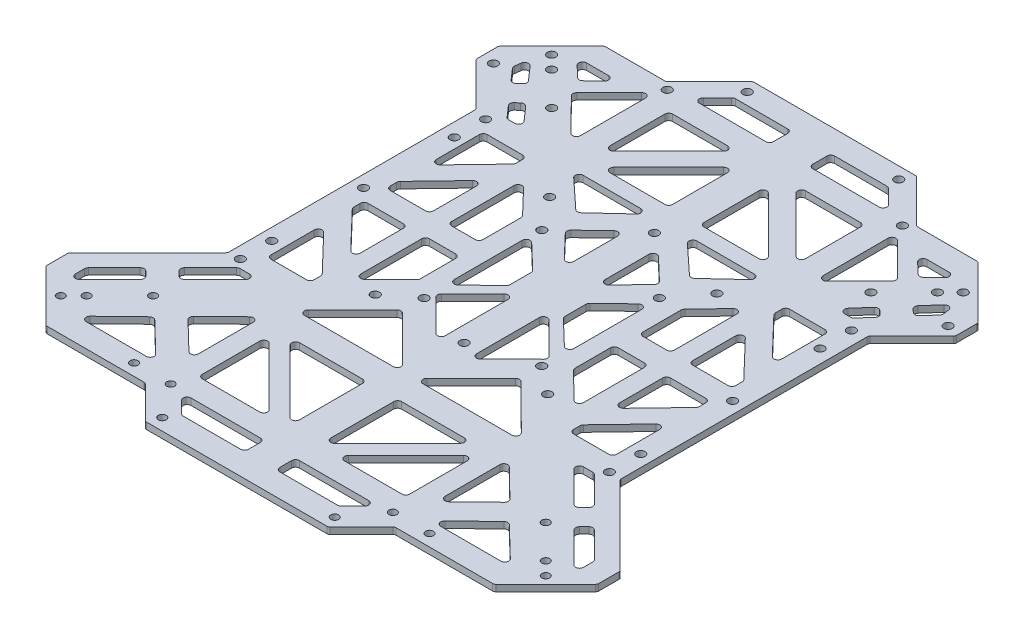
from build123d import *

# Parameters (mm, degrees)
Y_KSEKLIK_EKSTR_ZYON2_DEPTH = 2.5
IZIM2_R                     = 1.65
IZIM2_R_2                   = 1.5
KES_EKSTR_ZYON1_DEPTH       = 160.16888056
RADYUS1_R                   = 1.17
IZIM3_R                     = 1.5
KES_EKSTR_ZYON2_DEPTH       = 160.16888056


with BuildPart() as part:
    # Çizim1 → Yükseklik-Ekstrüzyon2 (new body)
    with BuildSketch(Plane(origin=(0, 0, 0), x_dir=(1, 0, 0), z_dir=(0, 1, 0))):
        Polygon((105.526911935, -86.605591591), (105.526911935, -77.905591591), (75.121320344, -47.5), (75.121320344, 0), (75.121320344, 47.5), (91.738329701, 64.117009358), (91.738329701, 72.817009358), (71.444365081, 93.110973978), (47.944365081, 93.110973978), (31.327355724, 109.727983336), (-31.327355724, 109.727983336), (-47.944365081, 93.110973978), (-71.444365081, 93.110973978), (-91.738329701, 72.817009358), (-91.738329701, 64.117009358), (-75.121320344, 47.5), (-75.121320344, 0), (-75.121320344, -47.5), (-105.526911935, -77.905591591), (-105.526911935, -86.605591591), (-85.727922061, -106.404581464), (-47.727922061, -106.404581464), (-35, -119.132503526), (35, -119.132503526), (47.727922061, -106.404581464), (85.727922061, -106.404581464), align=None)
        with BuildLine():
            ThreePointArc((-97.234776311, -80.134271247), (-97.12059561, -79.560246099), (-96.795436483, -79.073611076))
            Line((-96.795436483, -79.073611076), (-86.895941546, -69.174116139))
            ThreePointArc((-86.895941546, -69.174116139), (-85.835281374, -68.734776311), (-84.774621202, -69.174116139))
            Line((-84.774621202, -69.174116139), (-83.006854249, -70.941883092))
            ThreePointArc((-83.006854249, -70.941883092), (-82.567514421, -72.002543264), (-83.006854249, -73.063203436))
            Line((-83.006854249, -73.063203436), (-94.674116139, -84.730465325))
            ThreePointArc((-94.674116139, -84.730465325), (-96.308801459, -85.055624452), (-97.234776311, -83.669805153))
            Line((-97.234776311, -83.669805153), (-97.234776311, -80.134271247))
        make_face(mode=Mode.SUBTRACT)
        with BuildLine():
            ThreePointArc((-79.354169294, -97.404581464), (-80.74470651, -96.467081464), (-80.397072206, -94.826456464))
            Line((-80.397072206, -94.826456464), (-68.897072206, -83.702158734))
            ThreePointArc((-68.897072206, -83.702158734), (-67.854169294, -83.280283734), (-66.811266381, -83.702158734))
            Line((-66.811266381, -83.702158734), (-55.311266381, -94.826456464))
            ThreePointArc((-55.311266381, -94.826456464), (-54.963632077, -96.467081464), (-56.354169294, -97.404581464))
            Line((-56.354169294, -97.404581464), (-79.354169294, -97.404581464))
        make_face(mode=Mode.SUBTRACT)
        with BuildLine():
            ThreePointArc((-49.743420942, -64.54850747), (-48.112415402, -64.236585138), (-47.193257197, -65.619561208))
            Line((-47.193257197, -65.619561208), (-47.193257197, -86.619561208))
            ThreePointArc((-47.193257197, -86.619561208), (-48.107746467, -88.000567067), (-49.73616011, -87.697686208))
            Line((-49.73616011, -87.697686208), (-60.51741011, -77.268657085))
            ThreePointArc((-60.51741011, -77.268657085), (-60.974498637, -76.195599689), (-60.524670942, -75.119478347))
            Line((-60.524670942, -75.119478347), (-49.743420942, -64.54850747))
        make_face(mode=Mode.SUBTRACT)
        with BuildLine():
            ThreePointArc((-35.060660172, -105.193163697), (-35.385819299, -103.558478377), (-34, -102.632503526))
            Line((-34, -102.632503526), (-7.5, -102.632503526))
            ThreePointArc((-7.5, -102.632503526), (-6.439339828, -103.071843354), (-6, -104.132503526))
            Line((-6, -104.132503526), (-6, -108.632503526))
            ThreePointArc((-6, -108.632503526), (-6.439339828, -109.693163697), (-7.5, -110.132503526))
            Line((-7.5, -110.132503526), (-29.5, -110.132503526))
            ThreePointArc((-29.5, -110.132503526), (-30.074025149, -110.018322824), (-30.560660172, -109.693163697))
            Line((-30.560660172, -109.693163697), (-35.060660172, -105.193163697))
        make_face(mode=Mode.SUBTRACT)
        with BuildLine():
            Line((-37.132597026, -69.571843354), (-15.132597026, -91.571843354))
            ThreePointArc((-15.132597026, -91.571843354), (-14.807437899, -93.206528674), (-16.193257197, -94.132503526))
            Line((-16.193257197, -94.132503526), (-38.193257197, -94.132503526))
            ThreePointArc((-38.193257197, -94.132503526), (-39.253917369, -93.693163697), (-39.693257197, -92.632503526))
            Line((-39.693257197, -92.632503526), (-39.693257197, -70.632503526))
            ThreePointArc((-39.693257197, -70.632503526), (-38.767282346, -69.246684227), (-37.132597026, -69.571843354))
        make_face(mode=Mode.SUBTRACT)
        with BuildLine():
            ThreePointArc((-32.562493639, -66.108137897), (-32.885322218, -64.474090626), (-31.5, -63.549314368))
            Line((-31.5, -63.549314368), (-7.5, -63.549314368))
            ThreePointArc((-7.5, -63.549314368), (-6.439339828, -63.988654196), (-6, -65.049314368))
            Line((-6, -65.049314368), (-6, -89.132503526))
            ThreePointArc((-6, -89.132503526), (-6.927173874, -90.518818868), (-8.562493639, -90.191327055))
            Line((-8.562493639, -90.191327055), (-32.562493639, -66.108137897))
        make_face(mode=Mode.SUBTRACT)
        with BuildLine():
            Line((-78.410660172, -60.688834765), (-68.511165235, -50.789339828))
            ThreePointArc((-68.511165235, -50.789339828), (-68.024530212, -50.464180701), (-67.450505063, -50.35))
            Line((-67.450505063, -50.35), (-63.914971157, -50.35))
            ThreePointArc((-63.914971157, -50.35), (-62.529151859, -51.275974851), (-62.854310986, -52.910660172))
            Line((-62.854310986, -52.910660172), (-74.521572875, -64.577922061))
            ThreePointArc((-74.521572875, -64.577922061), (-75.582233047, -65.01726189), (-76.642893219, -64.577922061))
            Line((-76.642893219, -64.577922061), (-78.410660172, -62.810155108))
            ThreePointArc((-78.410660172, -62.810155108), (-78.85, -61.749494937), (-78.410660172, -60.688834765))
        make_face(mode=Mode.SUBTRACT)
        with BuildLine():
            ThreePointArc((-50.038916707, -36.382785741), (-49.729629743, -36.861606973), (-49.621320344, -37.421247279))
            Line((-49.621320344, -37.421247279), (-49.621320344, -39.85))
            ThreePointArc((-49.621320344, -39.85), (-50.060660172, -40.910660172), (-51.121320344, -41.35))
            Line((-51.121320344, -41.35), (-64.621320344, -41.35))
            ThreePointArc((-64.621320344, -41.35), (-65.681980515, -40.910660172), (-66.121320344, -39.85))
            Line((-66.121320344, -39.85), (-66.121320344, -23.35))
            ThreePointArc((-66.121320344, -23.35), (-65.18096065, -21.958309399), (-63.538916707, -22.311538462))
            Line((-63.538916707, -22.311538462), (-50.038916707, -36.382785741))
        make_face(mode=Mode.SUBTRACT)
        with BuildLine():
            ThreePointArc((-66.121320344, -5.754580613), (-65.681980515, -4.693920441), (-64.621320344, -4.254580613))
            Line((-64.621320344, -4.254580613), (-51.121320344, -4.254580613))
            ThreePointArc((-51.121320344, -4.254580613), (-50.060660172, -4.693920441), (-49.621320344, -5.754580613))
            Line((-49.621320344, -5.754580613), (-49.621320344, -22.254580613))
            ThreePointArc((-49.621320344, -22.254580613), (-50.561680037, -23.646271213), (-52.20372398, -23.293042151))
            Line((-52.20372398, -23.293042151), (-65.70372398, -9.221794872))
            ThreePointArc((-65.70372398, -9.221794872), (-66.013010944, -8.74297364), (-66.121320344, -8.183333333))
            Line((-66.121320344, -8.183333333), (-66.121320344, -5.754580613))
        make_face(mode=Mode.SUBTRACT)
        with BuildLine():
            ThreePointArc((-39.693257197, -53.549314368), (-41.079574261, -52.62213633), (-40.752074344, -50.986814368))
            Line((-40.752074344, -50.986814368), (-23.752074344, -34.045740022))
            ThreePointArc((-23.752074344, -34.045740022), (-22.693257197, -33.608240022), (-21.634440051, -34.045740022))
            Line((-21.634440051, -34.045740022), (-4.634440051, -50.986814368))
            ThreePointArc((-4.634440051, -50.986814368), (-4.306940134, -52.62213633), (-5.693257197, -53.549314368))
            Line((-5.693257197, -53.549314368), (-39.693257197, -53.549314368))
        make_face(mode=Mode.SUBTRACT)
        with BuildLine():
            ThreePointArc((-42.621320344, -5.75), (-42.181980515, -4.689339828), (-41.121320344, -4.25))
            Line((-41.121320344, -4.25), (-31.121320344, -4.25))
            ThreePointArc((-31.121320344, -4.25), (-30.060660172, -4.689339828), (-29.621320344, -5.75))
            Line((-29.621320344, -5.75), (-29.621320344, -19.25))
            ThreePointArc((-29.621320344, -19.25), (-29.738447975, -19.831088643), (-30.071539025, -20.321428571))
            Line((-30.071539025, -20.321428571), (-40.071539025, -30.119387543))
            ThreePointArc((-40.071539025, -30.119387543), (-41.702408987, -30.43083134), (-42.621320344, -29.047958971))
            Line((-42.621320344, -29.047958971), (-42.621320344, -5.75))
        make_face(mode=Mode.SUBTRACT)
        with BuildLine():
            ThreePointArc((-20.600418108, -22.370295469), (-21.041594579, -21.30780183), (-20.600418108, -20.245308191))
            Line((-20.600418108, -20.245308191), (-8.558823529, -8.245308191))
            ThreePointArc((-8.558823529, -8.245308191), (-6.924776258, -7.922479612), (-6, -9.30780183))
            Line((-6, -9.30780183), (-6, -33.30780183))
            ThreePointArc((-6, -33.30780183), (-6.924776258, -34.693124048), (-8.558823529, -34.370295469))
            Line((-8.558823529, -34.370295469), (-20.600418108, -22.370295469))
        make_face(mode=Mode.SUBTRACT)
        with BuildLine():
            Line((6, -108.632503526), (6, -104.132503526))
            ThreePointArc((6, -104.132503526), (6.439339828, -103.071843354), (7.5, -102.632503526))
            Line((7.5, -102.632503526), (34, -102.632503526))
            ThreePointArc((34, -102.632503526), (35.385819299, -103.558478377), (35.060660172, -105.193163697))
            Line((35.060660172, -105.193163697), (30.560660172, -109.693163697))
            ThreePointArc((30.560660172, -109.693163697), (30.074025149, -110.018322824), (29.5, -110.132503526))
            Line((29.5, -110.132503526), (7.5, -110.132503526))
            ThreePointArc((7.5, -110.132503526), (6.439339828, -109.693163697), (6, -108.632503526))
        make_face(mode=Mode.SUBTRACT)
        with BuildLine():
            Line((6, -89.132503526), (6, -65.049314368))
            ThreePointArc((6, -65.049314368), (6.439339828, -63.988654196), (7.5, -63.549314368))
            Line((7.5, -63.549314368), (31.5, -63.549314368))
            ThreePointArc((31.5, -63.549314368), (32.885322218, -64.474090626), (32.562493639, -66.108137897))
            Line((32.562493639, -66.108137897), (8.562493639, -90.191327055))
            ThreePointArc((8.562493639, -90.191327055), (6.927173874, -90.518818868), (6, -89.132503526))
        make_face(mode=Mode.SUBTRACT)
        with BuildLine():
            ThreePointArc((37.132597026, -69.571843354), (38.767282346, -69.246684227), (39.693257197, -70.632503526))
            Line((39.693257197, -70.632503526), (39.693257197, -92.632503526))
            ThreePointArc((39.693257197, -92.632503526), (39.253917369, -93.693163697), (38.193257197, -94.132503526))
            Line((38.193257197, -94.132503526), (16.193257197, -94.132503526))
            ThreePointArc((16.193257197, -94.132503526), (14.807437899, -93.206528674), (15.132597026, -91.571843354))
            Line((15.132597026, -91.571843354), (37.132597026, -69.571843354))
        make_face(mode=Mode.SUBTRACT)
        with BuildLine():
            Line((55.311266381, -94.826456464), (66.811266381, -83.702158734))
            ThreePointArc((66.811266381, -83.702158734), (67.854169294, -83.280283734), (68.897072206, -83.702158734))
            Line((68.897072206, -83.702158734), (80.397072206, -94.826456464))
            ThreePointArc((80.397072206, -94.826456464), (80.74470651, -96.467081464), (79.354169294, -97.404581464))
            Line((79.354169294, -97.404581464), (56.354169294, -97.404581464))
            ThreePointArc((56.354169294, -97.404581464), (54.963632077, -96.467081464), (55.311266381, -94.826456464))
        make_face(mode=Mode.SUBTRACT)
        with BuildLine():
            Line((60.51741011, -77.268657085), (49.73616011, -87.697686208))
            ThreePointArc((49.73616011, -87.697686208), (48.107746467, -88.000567067), (47.193257197, -86.619561208))
            Line((47.193257197, -86.619561208), (47.193257197, -65.619561208))
            ThreePointArc((47.193257197, -65.619561208), (48.112415402, -64.236585138), (49.743420942, -64.54850747))
            Line((49.743420942, -64.54850747), (60.524670942, -75.119478347))
            ThreePointArc((60.524670942, -75.119478347), (60.974498637, -76.195599689), (60.51741011, -77.268657085))
        make_face(mode=Mode.SUBTRACT)
        with BuildLine():
            Line((83.006854249, -70.941883092), (84.774621202, -69.174116139))
            ThreePointArc((84.774621202, -69.174116139), (85.835281374, -68.734776311), (86.895941546, -69.174116139))
            Line((86.895941546, -69.174116139), (96.795436483, -79.073611076))
            ThreePointArc((96.795436483, -79.073611076), (97.12059561, -79.560246099), (97.234776311, -80.134271247))
            Line((97.234776311, -80.134271247), (97.234776311, -83.669805153))
            ThreePointArc((97.234776311, -83.669805153), (96.308801459, -85.055624452), (94.674116139, -84.730465325))
            Line((94.674116139, -84.730465325), (83.006854249, -73.063203436))
            ThreePointArc((83.006854249, -73.063203436), (82.567514421, -72.002543264), (83.006854249, -70.941883092))
        make_face(mode=Mode.SUBTRACT)
        with BuildLine():
            Line((4.634440051, -50.986814368), (21.634440051, -34.045740022))
            ThreePointArc((21.634440051, -34.045740022), (22.693257197, -33.608240022), (23.752074344, -34.045740022))
            Line((23.752074344, -34.045740022), (40.752074344, -50.986814368))
            ThreePointArc((40.752074344, -50.986814368), (41.079574261, -52.62213633), (39.693257197, -53.549314368))
            Line((39.693257197, -53.549314368), (5.693257197, -53.549314368))
            ThreePointArc((5.693257197, -53.549314368), (4.306940134, -52.62213633), (4.634440051, -50.986814368))
        make_face(mode=Mode.SUBTRACT)
        with BuildLine():
            Line((6, -33.30780183), (6, -9.30780183))
            ThreePointArc((6, -9.30780183), (6.924776258, -7.922479612), (8.558823529, -8.245308191))
            Line((8.558823529, -8.245308191), (20.600418108, -20.245308191))
            ThreePointArc((20.600418108, -20.245308191), (21.041594579, -21.30780183), (20.600418108, -22.370295469))
            Line((20.600418108, -22.370295469), (8.558823529, -34.370295469))
            ThreePointArc((8.558823529, -34.370295469), (6.924776258, -34.693124048), (6, -33.30780183))
        make_face(mode=Mode.SUBTRACT)
        with BuildLine():
            Line((29.621320344, -19.25), (29.621320344, -5.75))
            ThreePointArc((29.621320344, -5.75), (30.060660172, -4.689339828), (31.121320344, -4.25))
            Line((31.121320344, -4.25), (41.121320344, -4.25))
            ThreePointArc((41.121320344, -4.25), (42.181980515, -4.689339828), (42.621320344, -5.75))
            Line((42.621320344, -5.75), (42.621320344, -29.047958971))
            ThreePointArc((42.621320344, -29.047958971), (41.702408987, -30.43083134), (40.071539025, -30.119387543))
            Line((40.071539025, -30.119387543), (30.071539025, -20.321428571))
            ThreePointArc((30.071539025, -20.321428571), (29.738447975, -19.831088643), (29.621320344, -19.25))
        make_face(mode=Mode.SUBTRACT)
        with BuildLine():
            ThreePointArc((62.854310986, -52.910660172), (62.529151859, -51.275974851), (63.914971157, -50.35))
            Line((63.914971157, -50.35), (67.450505063, -50.35))
            ThreePointArc((67.450505063, -50.35), (68.024530212, -50.464180701), (68.511165235, -50.789339828))
            Line((68.511165235, -50.789339828), (78.410660172, -60.688834765))
            ThreePointArc((78.410660172, -60.688834765), (78.85, -61.749494937), (78.410660172, -62.810155108))
            Line((78.410660172, -62.810155108), (76.642893219, -64.577922061))
            ThreePointArc((76.642893219, -64.577922061), (75.582233047, -65.01726189), (74.521572875, -64.577922061))
            Line((74.521572875, -64.577922061), (62.854310986, -52.910660172))
        make_face(mode=Mode.SUBTRACT)
        with BuildLine():
            Line((64.621320344, -41.35), (51.121320344, -41.35))
            ThreePointArc((51.121320344, -41.35), (50.060660172, -40.910660172), (49.621320344, -39.85))
            Line((49.621320344, -39.85), (49.621320344, -37.421247279))
            ThreePointArc((49.621320344, -37.421247279), (49.729629743, -36.861606973), (50.038916707, -36.382785741))
            Line((50.038916707, -36.382785741), (63.538916707, -22.311538462))
            ThreePointArc((63.538916707, -22.311538462), (65.18096065, -21.958309399), (66.121320344, -23.35))
            Line((66.121320344, -23.35), (66.121320344, -39.85))
            ThreePointArc((66.121320344, -39.85), (65.681980515, -40.910660172), (64.621320344, -41.35))
        make_face(mode=Mode.SUBTRACT)
        with BuildLine():
            Line((49.621320344, -22.254580613), (49.621320344, -5.754580613))
            ThreePointArc((49.621320344, -5.754580613), (50.060660172, -4.693920441), (51.121320344, -4.254580613))
            Line((51.121320344, -4.254580613), (64.621320344, -4.254580613))
            ThreePointArc((64.621320344, -4.254580613), (65.681980515, -4.693920441), (66.121320344, -5.754580613))
            Line((66.121320344, -5.754580613), (66.121320344, -8.183333333))
            ThreePointArc((66.121320344, -8.183333333), (66.013010944, -8.74297364), (65.70372398, -9.221794872))
            Line((65.70372398, -9.221794872), (52.20372398, -23.293042151))
            ThreePointArc((52.20372398, -23.293042151), (50.561680037, -23.646271213), (49.621320344, -22.254580613))
        make_face(mode=Mode.SUBTRACT)
        with BuildLine():
            Line((-51.121320344, 4.254580613), (-64.621320344, 4.254580613))
            ThreePointArc((-64.621320344, 4.254580613), (-65.681980515, 4.693920441), (-66.121320344, 5.754580613))
            Line((-66.121320344, 5.754580613), (-66.121320344, 8.183333333))
            ThreePointArc((-66.121320344, 8.183333333), (-66.013010944, 8.74297364), (-65.70372398, 9.221794872))
            Line((-65.70372398, 9.221794872), (-52.20372398, 23.293042151))
            ThreePointArc((-52.20372398, 23.293042151), (-50.561680037, 23.646271213), (-49.621320344, 22.254580613))
            Line((-49.621320344, 22.254580613), (-49.621320344, 5.754580613))
            ThreePointArc((-49.621320344, 5.754580613), (-50.060660172, 4.693920441), (-51.121320344, 4.254580613))
        make_face(mode=Mode.SUBTRACT)
        with BuildLine():
            Line((-49.621320344, 39.85), (-49.621320344, 37.421247279))
            ThreePointArc((-49.621320344, 37.421247279), (-49.729629743, 36.861606973), (-50.038916707, 36.382785741))
            Line((-50.038916707, 36.382785741), (-63.538916707, 22.311538462))
            ThreePointArc((-63.538916707, 22.311538462), (-65.18096065, 21.958309399), (-66.121320344, 23.35))
            Line((-66.121320344, 23.35), (-66.121320344, 39.85))
            ThreePointArc((-66.121320344, 39.85), (-65.681980515, 40.910660172), (-64.621320344, 41.35))
            Line((-64.621320344, 41.35), (-51.121320344, 41.35))
            ThreePointArc((-51.121320344, 41.35), (-50.060660172, 40.910660172), (-49.621320344, 39.85))
        make_face(mode=Mode.SUBTRACT)
        with BuildLine():
            Line((-42.621320344, 5.754580613), (-42.621320344, 29.635412132))
            ThreePointArc((-42.621320344, 29.635412132), (-41.68096065, 31.027102733), (-40.038916707, 30.673873671))
            Line((-40.038916707, 30.673873671), (-31.038916707, 21.293042151))
            ThreePointArc((-31.038916707, 21.293042151), (-30.729629743, 20.814220919), (-30.621320344, 20.254580613))
            Line((-30.621320344, 20.254580613), (-30.621320344, 5.754580613))
            ThreePointArc((-30.621320344, 5.754580613), (-31.060660172, 4.693920441), (-32.121320344, 4.254580613))
            Line((-32.121320344, 4.254580613), (-41.121320344, 4.254580613))
            ThreePointArc((-41.121320344, 4.254580613), (-42.181980515, 4.693920441), (-42.621320344, 5.754580613))
        make_face(mode=Mode.SUBTRACT)
        with BuildLine():
            ThreePointArc((-20.342369981, -14.082403637), (-21.969179925, -14.379799317), (-22.88083152, -13))
            Line((-22.88083152, -13), (-22.88083152, 0))
            Line((-22.88083152, 0), (-22.88083152, 13))
            ThreePointArc((-22.88083152, 13), (-21.969179925, 14.379799317), (-20.342369981, 14.082403637))
            Line((-20.342369981, 14.082403637), (-10.961538462, 5.082403637))
            ThreePointArc((-10.961538462, 5.082403637), (-10.620200683, 4.588348405), (-10.5, 4))
            Line((-10.5, 4), (-10.5, 0))
            Line((-10.5, 0), (-10.5, -4))
            ThreePointArc((-10.5, -4), (-10.620200683, -4.588348405), (-10.961538462, -5.082403637))
            Line((-10.961538462, -5.082403637), (-20.342369981, -14.082403637))
        make_face(mode=Mode.SUBTRACT)
        with BuildLine():
            ThreePointArc((-16.975952079, 23.590167211), (-17.390513959, 24.660754868), (-16.926633684, 25.710914177))
            Line((-16.926633684, 25.710914177), (-8.535714286, 33.720437987))
            ThreePointArc((-8.535714286, 33.720437987), (-6.909903156, 34.014457776), (-6, 32.635405306))
            Line((-6, 32.635405306), (-6, 15.835405306))
            ThreePointArc((-6, 15.835405306), (-6.942124127, 14.443006473), (-8.585032681, 14.79969102))
            Line((-8.585032681, 14.79969102), (-16.975952079, 23.590167211))
        make_face(mode=Mode.SUBTRACT)
        with BuildLine():
            ThreePointArc((-33.769803903, 43.598039027), (-34.146424004, 45.245761585), (-32.75, 46.198039027))
            Line((-32.75, 46.198039027), (-10.75, 46.198039027))
            ThreePointArc((-10.75, 46.198039027), (-9.353575996, 45.245761585), (-9.730196097, 43.598039027))
            Line((-9.730196097, 43.598039027), (-20.730196097, 33.4))
            ThreePointArc((-20.730196097, 33.4), (-21.75, 33), (-22.769803903, 33.4))
            Line((-22.769803903, 33.4), (-33.769803903, 43.598039027))
        make_face(mode=Mode.SUBTRACT)
        with BuildLine():
            Line((-66.51899774, 50.857567544), (-70.157916744, 54.981675749))
            ThreePointArc((-70.157916744, 54.981675749), (-70.530238828, 56.067675634), (-70.025592416, 57.098864988))
            Line((-70.025592416, 57.098864988), (-68.750868062, 58.223621771))
            ThreePointArc((-68.750868062, 58.223621771), (-67.664868177, 58.595943855), (-66.633678823, 58.091297443))
            Line((-66.633678823, 58.091297443), (-62.002327364, 52.842432456))
            ThreePointArc((-62.002327364, 52.842432456), (-61.759851781, 51.233010812), (-63.127084147, 50.35))
            Line((-63.127084147, 50.35), (-65.394240957, 50.35))
            ThreePointArc((-65.394240957, 50.35), (-66.011230145, 50.482767634), (-66.51899774, 50.857567544))
        make_face(mode=Mode.SUBTRACT)
        with BuildLine():
            ThreePointArc((-81.736295393, 68.103838218), (-82.044954591, 68.654322007), (-82.099865458, 69.283041101))
            Line((-82.099865458, 69.283041101), (-81.817573559, 71.532554668))
            ThreePointArc((-81.817573559, 71.532554668), (-80.771195378, 72.779200221), (-79.204489928, 72.338216695))
            Line((-79.204489928, 72.338216695), (-74.573138468, 67.089351708))
            ThreePointArc((-74.573138468, 67.089351708), (-74.200816384, 66.003351823), (-74.705462796, 64.972162469))
            Line((-74.705462796, 64.972162469), (-75.98018715, 63.847405686))
            ThreePointArc((-75.98018715, 63.847405686), (-77.066187035, 63.475083601), (-78.097376389, 63.979730013))
            Line((-78.097376389, 63.979730013), (-81.736295393, 68.103838218))
        make_face(mode=Mode.SUBTRACT)
        with BuildLine():
            ThreePointArc((-61.36607366, 70.295802584), (-61.798982954, 71.354556041), (-61.359650045, 72.410660172))
            Line((-61.359650045, 72.410660172), (-48.985281374, 84.785028843))
            ThreePointArc((-48.985281374, 84.785028843), (-47.350596054, 85.11018797), (-46.424621202, 83.724368671))
            Line((-46.424621202, 83.724368671), (-46.424621202, 58.824368671))
            ThreePointArc((-46.424621202, 58.824368671), (-47.354807935, 57.436812243), (-48.991704989, 57.770171255))
            Line((-48.991704989, 57.770171255), (-61.36607366, 70.295802584))
        make_face(mode=Mode.SUBTRACT)
        with BuildLine():
            Line((-59.923381618, 81.524767081), (-64.123381618, 77.524767081))
            ThreePointArc((-64.123381618, 77.524767081), (-65.157864376, 77.110973978), (-66.192347135, 77.524767081))
            Line((-66.192347135, 77.524767081), (-70.392347135, 81.524767081))
            ThreePointArc((-70.392347135, 81.524767081), (-70.750579413, 83.168059992), (-69.357864376, 84.110973978))
            Line((-69.357864376, 84.110973978), (-60.957864376, 84.110973978))
            ThreePointArc((-60.957864376, 84.110973978), (-59.56514934, 83.168059992), (-59.923381618, 81.524767081))
        make_face(mode=Mode.SUBTRACT)
        with BuildLine():
            ThreePointArc((-28.5, 52.198039027), (-29.885819299, 53.124013879), (-29.560660172, 54.758699199))
            Line((-29.560660172, 54.758699199), (-8.560660172, 75.758699199))
            ThreePointArc((-8.560660172, 75.758699199), (-6.925974851, 76.083858326), (-6, 74.698039027))
            Line((-6, 74.698039027), (-6, 53.698039027))
            ThreePointArc((-6, 53.698039027), (-6.439339828, 52.637378855), (-7.5, 52.198039027))
            Line((-7.5, 52.198039027), (-28.5, 52.198039027))
        make_face(mode=Mode.SUBTRACT)
        with BuildLine():
            Line((-13.863961031, 81.062000058), (-34.863961031, 60.062000058))
            ThreePointArc((-34.863961031, 60.062000058), (-36.498646351, 59.736840931), (-37.424621202, 61.12266023))
            Line((-37.424621202, 61.12266023), (-37.424621202, 82.12266023))
            ThreePointArc((-37.424621202, 82.12266023), (-36.985281374, 83.183320401), (-35.924621202, 83.62266023))
            Line((-35.924621202, 83.62266023), (-14.924621202, 83.62266023))
            ThreePointArc((-14.924621202, 83.62266023), (-13.538801904, 82.696685378), (-13.863961031, 81.062000058))
        make_face(mode=Mode.SUBTRACT)
        with BuildLine():
            Line((-7.5, 99.227983336), (-7.5, 93.827983336))
            ThreePointArc((-7.5, 93.827983336), (-7.939339828, 92.767323164), (-9, 92.327983336))
            Line((-9, 92.327983336), (-34.4, 92.327983336))
            ThreePointArc((-34.4, 92.327983336), (-35.785568701, 93.253353564), (-35.461585368, 94.887717503))
            Line((-35.461585368, 94.887717503), (-30.071001931, 100.287717503))
            ThreePointArc((-30.071001931, 100.287717503), (-29.584046334, 100.613552037), (-29.009416563, 100.727983336))
            Line((-29.009416563, 100.727983336), (-9, 100.727983336))
            ThreePointArc((-9, 100.727983336), (-7.939339828, 100.288643508), (-7.5, 99.227983336))
        make_face(mode=Mode.SUBTRACT)
        with BuildLine():
            Line((10.5, -4), (10.5, 4))
            ThreePointArc((10.5, 4), (10.620200683, 4.588348405), (10.961538462, 5.082403637))
            Line((10.961538462, 5.082403637), (20.342369981, 14.082403637))
            ThreePointArc((20.342369981, 14.082403637), (21.969179925, 14.379799317), (22.88083152, 13))
            Line((22.88083152, 13), (22.88083152, -13))
            ThreePointArc((22.88083152, -13), (21.969179925, -14.379799317), (20.342369981, -14.082403637))
            Line((20.342369981, -14.082403637), (10.961538462, -5.082403637))
            ThreePointArc((10.961538462, -5.082403637), (10.620200683, -4.588348405), (10.5, -4))
        make_face(mode=Mode.SUBTRACT)
        with BuildLine():
            ThreePointArc((42.621320344, 5.754580613), (42.181980515, 4.693920441), (41.121320344, 4.254580613))
            Line((41.121320344, 4.254580613), (32.121320344, 4.254580613))
            ThreePointArc((32.121320344, 4.254580613), (31.060660172, 4.693920441), (30.621320344, 5.754580613))
            Line((30.621320344, 5.754580613), (30.621320344, 20.254580613))
            ThreePointArc((30.621320344, 20.254580613), (30.729629743, 20.814220919), (31.038916707, 21.293042151))
            Line((31.038916707, 21.293042151), (40.038916707, 30.673873671))
            ThreePointArc((40.038916707, 30.673873671), (41.68096065, 31.027102733), (42.621320344, 29.635412132))
            Line((42.621320344, 29.635412132), (42.621320344, 5.754580613))
        make_face(mode=Mode.SUBTRACT)
        with BuildLine():
            Line((6, 15.835405306), (6, 32.635405306))
            ThreePointArc((6, 32.635405306), (6.909903156, 34.014457776), (8.535714286, 33.720437987))
            Line((8.535714286, 33.720437987), (16.926633684, 25.710914177))
            ThreePointArc((16.926633684, 25.710914177), (17.390513959, 24.660754868), (16.975952079, 23.590167211))
            Line((16.975952079, 23.590167211), (8.585032681, 14.79969102))
            ThreePointArc((8.585032681, 14.79969102), (6.942124127, 14.443006473), (6, 15.835405306))
        make_face(mode=Mode.SUBTRACT)
        with BuildLine():
            Line((20.730196097, 33.4), (9.730196097, 43.598039027))
            ThreePointArc((9.730196097, 43.598039027), (9.353575996, 45.245761585), (10.75, 46.198039027))
            Line((10.75, 46.198039027), (32.75, 46.198039027))
            ThreePointArc((32.75, 46.198039027), (34.146424004, 45.245761585), (33.769803903, 43.598039027))
            Line((33.769803903, 43.598039027), (22.769803903, 33.4))
            ThreePointArc((22.769803903, 33.4), (21.75, 33), (20.730196097, 33.4))
        make_face(mode=Mode.SUBTRACT)
        with BuildLine():
            ThreePointArc((65.70372398, 9.221794872), (66.013010944, 8.74297364), (66.121320344, 8.183333333))
            Line((66.121320344, 8.183333333), (66.121320344, 5.754580613))
            ThreePointArc((66.121320344, 5.754580613), (65.681980515, 4.693920441), (64.621320344, 4.254580613))
            Line((64.621320344, 4.254580613), (51.121320344, 4.254580613))
            ThreePointArc((51.121320344, 4.254580613), (50.060660172, 4.693920441), (49.621320344, 5.754580613))
            Line((49.621320344, 5.754580613), (49.621320344, 22.254580613))
            ThreePointArc((49.621320344, 22.254580613), (50.561680037, 23.646271213), (52.20372398, 23.293042151))
            Line((52.20372398, 23.293042151), (65.70372398, 9.221794872))
        make_face(mode=Mode.SUBTRACT)
        with BuildLine():
            ThreePointArc((66.121320344, 23.35), (65.18096065, 21.958309399), (63.538916707, 22.311538462))
            Line((63.538916707, 22.311538462), (50.038916707, 36.382785741))
            ThreePointArc((50.038916707, 36.382785741), (49.729629743, 36.861606973), (49.621320344, 37.421247279))
            Line((49.621320344, 37.421247279), (49.621320344, 39.85))
            ThreePointArc((49.621320344, 39.85), (50.060660172, 40.910660172), (51.121320344, 41.35))
            Line((51.121320344, 41.35), (64.621320344, 41.35))
            ThreePointArc((64.621320344, 41.35), (65.681980515, 40.910660172), (66.121320344, 39.85))
            Line((66.121320344, 39.85), (66.121320344, 23.35))
        make_face(mode=Mode.SUBTRACT)
        with BuildLine():
            Line((6, 53.698039027), (6, 74.698039027))
            ThreePointArc((6, 74.698039027), (6.925974851, 76.083858326), (8.560660172, 75.758699199))
            Line((8.560660172, 75.758699199), (29.560660172, 54.758699199))
            ThreePointArc((29.560660172, 54.758699199), (29.885819299, 53.124013879), (28.5, 52.198039027))
            Line((28.5, 52.198039027), (7.5, 52.198039027))
            ThreePointArc((7.5, 52.198039027), (6.439339828, 52.637378855), (6, 53.698039027))
        make_face(mode=Mode.SUBTRACT)
        with BuildLine():
            ThreePointArc((35.924621202, 83.62266023), (36.985281374, 83.183320401), (37.424621202, 82.12266023))
            Line((37.424621202, 82.12266023), (37.424621202, 61.12266023))
            ThreePointArc((37.424621202, 61.12266023), (36.498646351, 59.736840931), (34.863961031, 60.062000058))
            Line((34.863961031, 60.062000058), (13.863961031, 81.062000058))
            ThreePointArc((13.863961031, 81.062000058), (13.538801904, 82.696685378), (14.924621202, 83.62266023))
            Line((14.924621202, 83.62266023), (35.924621202, 83.62266023))
        make_face(mode=Mode.SUBTRACT)
        with BuildLine():
            ThreePointArc((7.5, 99.227983336), (7.939339828, 100.288643508), (9, 100.727983336))
            Line((9, 100.727983336), (29.009416563, 100.727983336))
            ThreePointArc((29.009416563, 100.727983336), (29.584046334, 100.613552037), (30.071001931, 100.287717503))
            Line((30.071001931, 100.287717503), (35.461585368, 94.887717503))
            ThreePointArc((35.461585368, 94.887717503), (35.785568701, 93.253353564), (34.4, 92.327983336))
            Line((34.4, 92.327983336), (9, 92.327983336))
            ThreePointArc((9, 92.327983336), (7.939339828, 92.767323164), (7.5, 93.827983336))
            Line((7.5, 93.827983336), (7.5, 99.227983336))
        make_face(mode=Mode.SUBTRACT)
        with BuildLine():
            ThreePointArc((63.127084147, 50.35), (61.759851781, 51.233010812), (62.002327364, 52.842432456))
            Line((62.002327364, 52.842432456), (66.633678823, 58.091297443))
            ThreePointArc((66.633678823, 58.091297443), (67.664868177, 58.595943855), (68.750868062, 58.223621771))
            Line((68.750868062, 58.223621771), (70.025592416, 57.098864988))
            ThreePointArc((70.025592416, 57.098864988), (70.530238828, 56.067675634), (70.157916744, 54.981675749))
            Line((70.157916744, 54.981675749), (66.51899774, 50.857567544))
            ThreePointArc((66.51899774, 50.857567544), (66.011230145, 50.482767634), (65.394240957, 50.35))
            Line((65.394240957, 50.35), (63.127084147, 50.35))
        make_face(mode=Mode.SUBTRACT)
        with BuildLine():
            Line((46.424621202, 58.824368671), (46.424621202, 83.724368671))
            ThreePointArc((46.424621202, 83.724368671), (47.350596054, 85.11018797), (48.985281374, 84.785028843))
            Line((48.985281374, 84.785028843), (61.359650045, 72.410660172))
            ThreePointArc((61.359650045, 72.410660172), (61.798982954, 71.354556041), (61.36607366, 70.295802584))
            Line((61.36607366, 70.295802584), (48.991704989, 57.770171255))
            ThreePointArc((48.991704989, 57.770171255), (47.354807935, 57.436812243), (46.424621202, 58.824368671))
        make_face(mode=Mode.SUBTRACT)
        with BuildLine():
            ThreePointArc((59.923381618, 81.524767081), (59.56514934, 83.168059992), (60.957864376, 84.110973978))
            Line((60.957864376, 84.110973978), (69.357864376, 84.110973978))
            ThreePointArc((69.357864376, 84.110973978), (70.750579413, 83.168059992), (70.392347135, 81.524767081))
            Line((70.392347135, 81.524767081), (66.192347135, 77.524767081))
            ThreePointArc((66.192347135, 77.524767081), (65.157864376, 77.110973978), (64.123381618, 77.524767081))
            Line((64.123381618, 77.524767081), (59.923381618, 81.524767081))
        make_face(mode=Mode.SUBTRACT)
        with BuildLine():
            Line((81.736295393, 68.103838218), (78.097376389, 63.979730013))
            ThreePointArc((78.097376389, 63.979730013), (77.066187035, 63.475083601), (75.98018715, 63.847405686))
            Line((75.98018715, 63.847405686), (74.705462796, 64.972162469))
            ThreePointArc((74.705462796, 64.972162469), (74.200816384, 66.003351823), (74.573138468, 67.089351708))
            Line((74.573138468, 67.089351708), (79.204489928, 72.338216695))
            ThreePointArc((79.204489928, 72.338216695), (80.771195378, 72.779200221), (81.817573559, 71.532554668))
            Line((81.817573559, 71.532554668), (82.099865458, 69.283041101))
            ThreePointArc((82.099865458, 69.283041101), (82.044954591, 68.654322007), (81.736295393, 68.103838218))
        make_face(mode=Mode.SUBTRACT)
    extrude(amount=Y_KSEKLIK_EKSTR_ZYON2_DEPTH)

    # Çizim2 → Kes-Ekstrüzyon1 (cut, through all)
    with BuildSketch(Plane(origin=(0, 2.5, 0), x_dir=(1, 0, 0), z_dir=(0, 1, 0))):
        with Locations((-29, 105.227983336)):
            Circle(IZIM2_R)
        with Locations((-45, 90.610973978)):
            Circle(IZIM2_R)
        with Locations((0, 40.727983336)):
            Circle(IZIM2_R)
        with Locations((-73.820243866, 75.192888143)):
            Circle(IZIM2_R)
        with Locations((-61.092321805, 62.464966081)):
            Circle(IZIM2_R)
        with Locations((-87, 66.110973978)):
            Circle(IZIM2_R)
        with Locations((-70, 46.110973978)):
            Circle(IZIM2_R)
        with Locations((-70, 34.110973978)):
            Circle(IZIM2_R)
        with Locations((-22.5, 20.110973978)):
            Circle(IZIM2_R)
        with Locations((-70.621320344, 0)):
            Circle(IZIM2_R)
        with Locations((22.5, 20.110973978)):
            Circle(IZIM2_R)
        with Locations((70, 34.110973978)):
            Circle(IZIM2_R)
        with Locations((70, 46.110973978)):
            Circle(IZIM2_R)
        with Locations((87, 66.110973978)):
            Circle(IZIM2_R)
        with Locations((61.092321805, 62.464966081)):
            Circle(IZIM2_R)
        with Locations((73.820243866, 75.192888143)):
            Circle(IZIM2_R)
        with Locations((45, 90.610973978)):
            Circle(IZIM2_R)
        with Locations((29, 105.227983336)):
            Circle(IZIM2_R)
        with Locations((70.621320344, 0)):
            Circle(IZIM2_R)
        with Locations((-32, 32.610973978)):
            Circle(IZIM2_R)
        with Locations((32, 32.610973978)):
            Circle(IZIM2_R)
        with Locations((-33, -114.632503526)):
            Circle(IZIM2_R_2)
        with Locations((-22.5, -24.932503526)):
            Circle(IZIM2_R)
        with Locations((-70.621320344, -35.132503526)):
            Circle(IZIM2_R)
        with Locations((0, -32.132503526)):
            Circle(IZIM2_R)
        with Locations((-87.856313473, -88.733983002)):
            Circle(IZIM2_R_2)
        with Locations((-56.526911935, -101.904581464)):
            Circle(IZIM2_R_2)
        with Locations((-42.526911935, -101.904581464)):
            Circle(IZIM2_R_2)
        with Locations((-70.621320344, -47.132503526)):
            Circle(IZIM2_R)
        with Locations((70.621320344, -47.132503526)):
            Circle(IZIM2_R)
        with Locations((42.526911935, -101.904581464)):
            Circle(IZIM2_R_2)
        with Locations((56.526911935, -101.904581464)):
            Circle(IZIM2_R_2)
        with Locations((87.856313473, -88.733983002)):
            Circle(IZIM2_R_2)
        with Locations((70.621320344, -35.132503526)):
            Circle(IZIM2_R)
        with Locations((22.5, -24.932503526)):
            Circle(IZIM2_R)
        with Locations((33, -114.632503526)):
            Circle(IZIM2_R_2)
        with Locations((-33, -33.132503526)):
            Circle(IZIM2_R)
        with Locations((33, -33.132503526)):
            Circle(IZIM2_R)
        with Locations((-92.798989873, -93.676659403)):
            Circle(IZIM2_R_2)
        with Locations((92.798989873, -93.676659403)):
            Circle(IZIM2_R_2)
        with Locations((-78.762920267, 80.135564543)):
            Circle(IZIM2_R)
        with Locations((78.762920267, 80.135564543)):
            Circle(IZIM2_R)
    extrude(amount=-KES_EKSTR_ZYON1_DEPTH, mode=Mode.SUBTRACT)

    # Radyus1
    radyus1_edges = [part.edges().sort_by_distance(p)[0] for p in [
        (-91.738329701, 1.25, -64.117009358),
        (-91.738329701, 1.25, -72.817009358),
        (-71.444365081, 1.25, -93.110973978),
        (-47.944365081, 1.25, -93.110973978),
        (-31.327355724, 1.25, -109.727983336),
        (31.327355724, 1.25, -109.727983336),
        (47.944365081, 1.25, -93.110973978),
        (71.444365081, 1.25, -93.110973978),
        (91.738329701, 1.25, -72.817009358),
        (91.738329701, 1.25, -64.117009358),
        (75.121320344, 1.25, -47.5),
        (75.121320344, 1.25, 47.5),
        (105.526911935, 1.25, 77.905591591),
        (105.526911935, 1.25, 86.605591591),
        (85.727922061, 1.25, 106.404581464),
        (35, 1.25, 119.132503526),
        (-35, 1.25, 119.132503526),
        (-47.727922061, 1.25, 106.404581464),
        (-85.727922061, 1.25, 106.404581464),
        (-105.526911935, 1.25, 86.605591591),
        (-105.526911935, 1.25, 77.905591591),
        (-75.121320344, 1.25, 47.5),
        (-75.121320344, 1.25, -47.5),
        (47.727922061, 1.25, 106.404581464),
    ]]
    fillet(radyus1_edges, radius=RADYUS1_R)

    # Çizim3 → Kes-Ekstrüzyon2 (cut, through all)
    with BuildSketch(Plane(origin=(0, 2.5, 0), x_dir=(1, 0, 0), z_dir=(0, 1, 0))):
        with Locations((-75.128391411, -76.006060941)):
            Circle(IZIM3_R)
        with Locations((75.128391411, -76.006060941)):
            Circle(IZIM3_R)
    extrude(amount=-KES_EKSTR_ZYON2_DEPTH, mode=Mode.SUBTRACT)


solid = part.part
